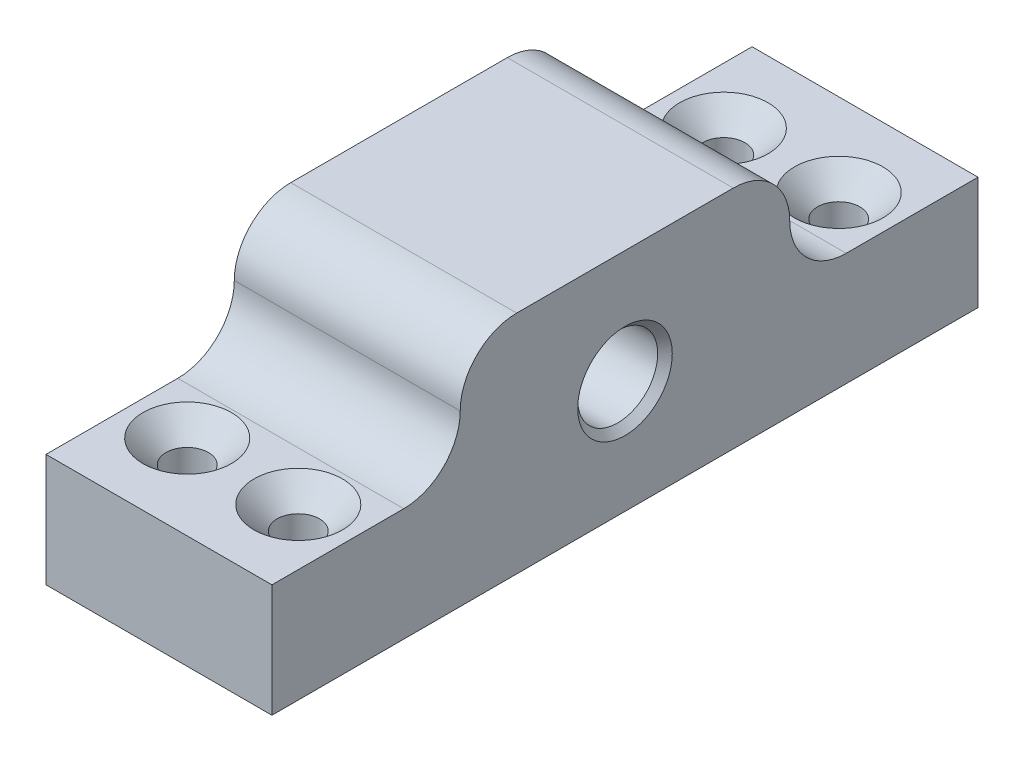
from build123d import *

# Parameters (mm, degrees)
SKETCH1_W                                       = 75
SKETCH1_H                                       = 24
BOSS_EXTRUDE1_DEPTH                             = 24
SKETCH2_W                                       = 20
SKETCH2_H                                       = 12
CUT_EXTRUDE1_DEPTH                              = 24
FILLET1_START                                   = -1
FILLET1_DEPTH                                   = 26
FILLET1_2_DEPTH                                 = 24
CSK_FOR_M4_FLAT_HEAD_MACHINE_SCREW1_D           = 4.5
CSK_FOR_M4_FLAT_HEAD_MACHINE_SCREW1_CSINK_D     = 9.4
CSK_FOR_M4_FLAT_HEAD_MACHINE_SCREW1_CSINK_ANGLE = 90
M10X1_5_TAPPED_HOLE1_D                          = 8.5
M10X1_5_TAPPED_HOLE1_CSINK_D                    = 10.05
M10X1_5_TAPPED_HOLE1_CSINK_ANGLE                = 90


with BuildPart() as part:
    # Sketch1 → Boss-Extrude1 (new body)
    with BuildSketch(Plane(origin=(0, 0, 0), x_dir=(0, 0, -1), z_dir=(1, 0, 0))):
        Rectangle(SKETCH1_W, SKETCH1_H)
    extrude(amount=BOSS_EXTRUDE1_DEPTH)

    # Sketch2 → Cut-Extrude1 (cut)
    with BuildSketch(Plane(origin=(24, 0, 0), x_dir=(0, 0, -1), z_dir=(1, 0, 0))):
        with Locations((-27.5, 6)):
            Rectangle(SKETCH2_W, SKETCH2_H)
    cut_extrude1 = extrude(amount=-CUT_EXTRUDE1_DEPTH, mode=Mode.SUBTRACT)

    # Fillet1: read off the stored shape, not the designer's step
    # Fillet1 outline → Fillet1 (cut)
    with BuildSketch(Plane.YZ.offset(FILLET1_START)):
        with BuildLine():
            Line((12, 17.5), (6, 17.5))
            ThreePointArc((6, 17.5), (10.242640687, 15.742640687), (12, 11.5))
            Line((12, 11.5), (12, 17.5))
        make_face()
    fillet1 = extrude(amount=FILLET1_DEPTH, mode=Mode.SUBTRACT)

    # Fillet1 2 outline → Fillet1 2 (add)
    with BuildSketch(Plane.YZ):
        with BuildLine():
            Line((0, 17.5), (6, 17.5))
            ThreePointArc((6, 17.5), (1.757359313, 19.257359313), (0, 23.5))
            Line((0, 23.5), (0, 17.5))
        make_face()
    fillet1_2 = extrude(amount=FILLET1_2_DEPTH)

    # CSK for M4 Flat Head Machine Screw1 (through all)
    with Locations(Plane(origin=(0, 0, 0), x_dir=(1, 0, 0), z_dir=(0, 1, 0))):
        with Locations((6, -28.5), (18, -28.702489343)):
            csk_for_m4_flat_head_machine_screw1 = CounterSinkHole(CSK_FOR_M4_FLAT_HEAD_MACHINE_SCREW1_D / 2, CSK_FOR_M4_FLAT_HEAD_MACHINE_SCREW1_CSINK_D / 2, counter_sink_angle=CSK_FOR_M4_FLAT_HEAD_MACHINE_SCREW1_CSINK_ANGLE)

    # Mirror1: Cut-Extrude1, Fillet1, Fillet1 2, CSK for M4 Flat Head Machine Screw1 across plane
    add(cut_extrude1.mirror(Plane.XY), mode=Mode.SUBTRACT)
    add(fillet1.mirror(Plane.XY), mode=Mode.SUBTRACT)
    add(fillet1_2.mirror(Plane.XY))
    add(csk_for_m4_flat_head_machine_screw1.mirror(Plane.XY), mode=Mode.SUBTRACT)

    # M10x1.5 Tapped Hole1 (through all)
    with Locations(Plane(origin=(24, 0, 0), x_dir=(0, 0, -1), z_dir=(1, 0, 0))):
        with Locations((0, 0)):
            CounterSinkHole(M10X1_5_TAPPED_HOLE1_D / 2, M10X1_5_TAPPED_HOLE1_CSINK_D / 2, counter_sink_angle=M10X1_5_TAPPED_HOLE1_CSINK_ANGLE)


solid = part.part
